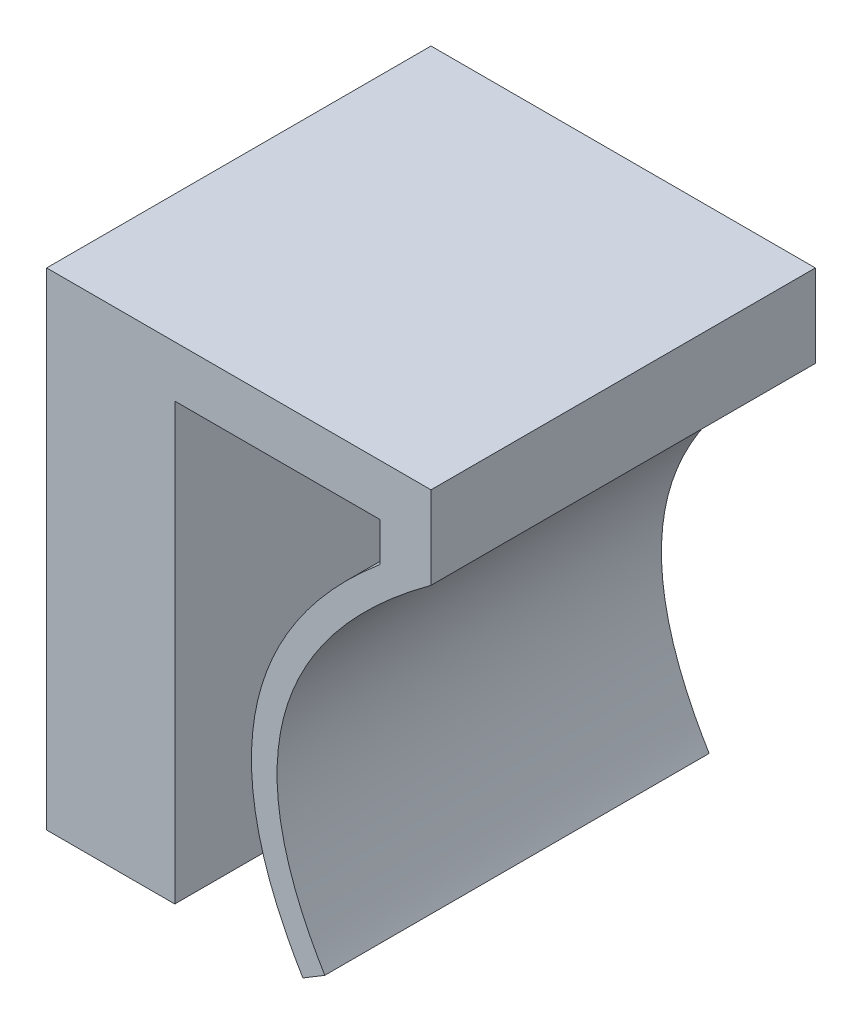
from build123d import *

# Parameters (mm, degrees)
AUFSATZ_LINEAR_AUSTRAGEN1_DEPTH = 15
SKIZZE2_W                       = 15
SKIZZE2_H                       = 19
AUFSATZ_LINEAR_AUSTRAGEN2_DEPTH = 3
SCHNITT_LINEAR_AUSTRAGEN1_DEPTH = 2
SKIZZE5_W                       = 15
SKIZZE5_H                       = 19
AUFSATZ_LINEAR_AUSTRAGEN4_DEPTH = 0.5


# Read off the part's stored shape, not the designer's step: Aufsatz-Linear austragen1
with BuildPart() as part:
    # Aufsatz-Linear austragen1 outline → Aufsatz-Linear austragen1 (new body)
    with BuildSketch(Plane.XY):
        with BuildLine():
            Line((9, 7.5), (9, 5.971762746))
            add(Edge.make_bspline(
                [(9, 5.971762746), (0.820844208, -0.941876975), (6, -9.5)],
                knots=[0.100732064, 0.100732064, 0.100732064, 1, 1, 1], degree=2))
            Line((6, -9.5), (6.855533767, -8.982252983))
            add(Edge.make_bspline(
                [(11, 6.271626074), (10.77340825, 6.105599677), (10.141366733, 5.627846644), (8.84701886, 4.547968637), (7.334591853, 2.994846091), (6.045831159, 1.119520738), (5.251441489, -0.76880078), (4.926102544, -2.686703365), (5.056978024, -4.672427827), (5.564804841, -6.418461308), (6.213216116, -7.858576344), (6.635759495, -8.619102834), (6.855533767, -8.982252983)],
                knots=[0.028407204, 0.028407204, 0.028407204, 0.028407204, 0.0625, 0.125, 0.25, 0.375, 0.5, 0.625, 0.75, 0.875, 0.9375, 1, 1, 1, 1], degree=3))
            Line((11, 6.271626074), (11, 9.5))
            Line((11, 9.5), (-1, 9.5))
            Line((-1, 9.5), (-1, -9.5))
            Line((-1, -9.5), (1, -9.5))
            Line((1, -9.5), (1, 7.5))
            Line((1, 7.5), (9, 7.5))
        make_face()
    extrude(amount=AUFSATZ_LINEAR_AUSTRAGEN1_DEPTH)

    # Skizze2 → Aufsatz-Linear austragen2 (add)
    with BuildSketch(Plane.ZY.offset(1)):
        with Locations((7.5, 0)):
            Rectangle(SKIZZE2_W, SKIZZE2_H)
    extrude(amount=AUFSATZ_LINEAR_AUSTRAGEN2_DEPTH)

    # Skizze3 → Schnitt-Linear austragen1 (cut)
    with BuildSketch(Plane.ZY.offset(4)):
        with BuildLine():
            Line((4.25, -0.5), (4.25, 1))
            ThreePointArc((4.25, 1), (7.5, 4.25), (10.75, 1))
            Line((10.75, 1), (10.75, -0.5))
            ThreePointArc((10.75, -0.5), (7.5, -3.75), (4.25, -0.5))
        make_face()
    extrude(amount=-SCHNITT_LINEAR_AUSTRAGEN1_DEPTH, mode=Mode.SUBTRACT)

    # Skizze5 → Aufsatz-Linear austragen4 (add)
    with BuildSketch(Plane.ZY.offset(4)):
        with Locations((7.5, 0)):
            Rectangle(SKIZZE5_W, SKIZZE5_H)
    extrude(amount=-AUFSATZ_LINEAR_AUSTRAGEN4_DEPTH)


solid = part.part
